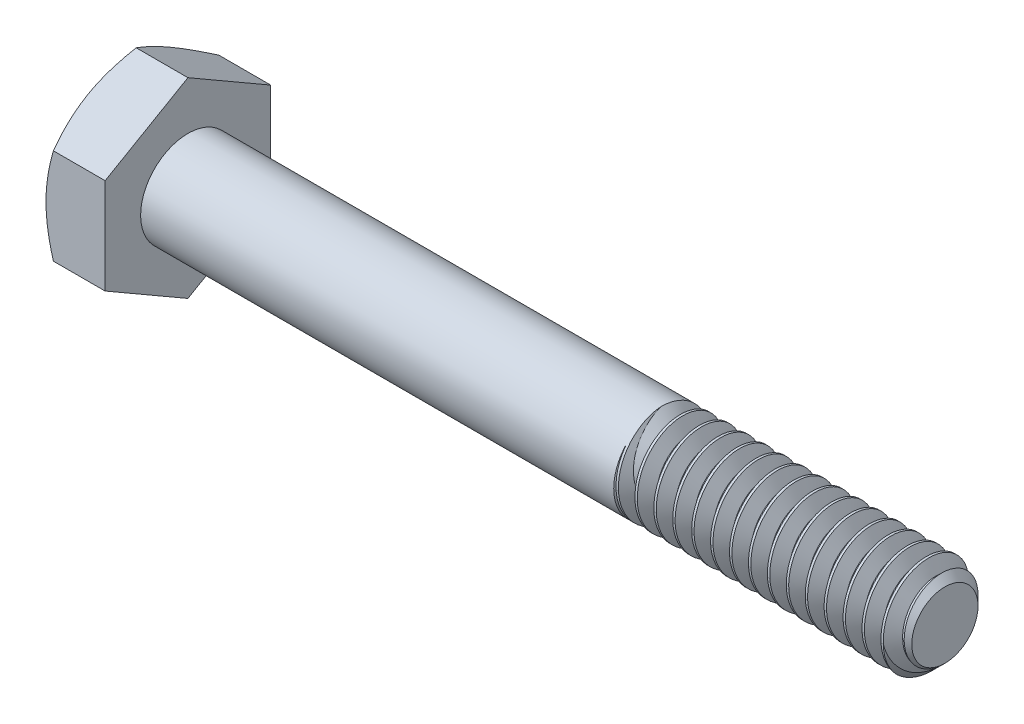
from build123d import *

# Parameters (mm, degrees)
SKETCH5_R           = 3.175
BOSS_EXTRUDE3_DEPTH = 50.8
CHAMFER1_SIZE       = 0.9525
CUT_SWEEP1_PITCH    = 1.27
BOSS_EXTRUDE4_DEPTH = 3.96875
SKETCH8_OUTSIDE_W   = 220.032
SKETCH8_OUTSIDE_H   = 221.752
SKETCH8_OUTSIDE_R   = 5.55625
CUT_EXTRUDE3_DEPTH  = 56.422472461
CUT_EXTRUDE3_DRAFT  = -60


with BuildPart() as part:
    # Sketch5 → Boss-Extrude3 (new body)
    with BuildSketch(Plane(origin=(27.384375, 0, 0), x_dir=(0, 0, -1), z_dir=(1, 0, 0))):
        Circle(SKETCH5_R)
    extrude(amount=-BOSS_EXTRUDE3_DEPTH)

    # Chamfer1
    chamfer1_edges = [part.edges().sort_by_distance(p)[0] for p in [
        (27.384375, 0, 3.175),
    ]]
    chamfer(chamfer1_edges, length=CHAMFER1_SIZE)

    # Cut-Sweep1: the profile of Sketch10 profile screwed along a right-hand helix of 16 turns, 8 arcs to a turn; built about Z, then put on its axis
    cut_sweep1_z = Axis((0, 0, 0), (0, 0, 1))
    cut_sweep1_corners = [(3.1753, 0, 0.000173205), (2.350110803, 0, -0.47625), (2.350110803, 0, -0.635), (3.1753, 0, -1.111423205)]
    with BuildLine(mode=Mode.PRIVATE) as cut_sweep1_profile:
        Line(cut_sweep1_corners[0], cut_sweep1_corners[1])
        Line(cut_sweep1_corners[1], cut_sweep1_corners[2])
        Line(cut_sweep1_corners[2], cut_sweep1_corners[3])
        Line(cut_sweep1_corners[3], cut_sweep1_corners[0])
    cut_sweep1_cap = Face(cut_sweep1_profile.wire())
    cut_sweep1_turn_angles = [0, 22.5, 45, 67.5, 90, 112.5, 135, 157.5, 180, 202.5, 225, 247.5, 270, 292.5, 315, 337.5, 360]
    cut_sweep1_turn_weights = [1, 0.9238795325112867, 1, 0.9238795325112867, 1, 0.9238795325112867, 1, 0.9238795325112867, 1, 0.9238795325112867, 1, 0.9238795325112867, 1, 0.9238795325112867, 1, 0.9238795325112867, 1]
    cut_sweep1_turn_rails = [Edge.make_bspline([Vector(p[0], p[1], 0).rotate(cut_sweep1_z, cut_sweep1_turn_angles[k]) / cut_sweep1_turn_weights[k] + Vector(0, 0, p[2] + CUT_SWEEP1_PITCH * cut_sweep1_turn_angles[k] / 360) for k in range(17)], [0, 0, 0, 1, 1, 2, 2, 3, 3, 4, 4, 5, 5, 6, 6, 7, 7, 8, 8, 8], 2, cut_sweep1_turn_weights) for p in cut_sweep1_corners]
    cut_sweep1_turn_sides = [Face.make_surface_from_curves(cut_sweep1_turn_rails[p[0]], cut_sweep1_turn_rails[p[1]]) for p in [(0, 1), (1, 2), (2, 3), (3, 0)]]
    cut_sweep1 = Plane(origin=(27.384375, 0, 0), x_dir=(0, 1, 0), z_dir=(-1, 0, 0)) * Solid(Shell([*[p.moved(Location((0, 0, CUT_SWEEP1_PITCH * i))) for i in range(16) for p in cut_sweep1_turn_sides], cut_sweep1_cap, cut_sweep1_cap.rotate(cut_sweep1_z, 5760).moved(Location((0, 0, CUT_SWEEP1_PITCH * 5760 / 360)))]))
    add(cut_sweep1, mode=Mode.SUBTRACT)

    # Sketch11 → Revolve1 (revolve)
    with BuildSketch(Plane.XY, mode=Mode.PRIVATE) as revolve1_sk:
        Polygon((-23.415625, 3.175), (-23.415625, 0), (11.509375, 0), (8.334375, 3.175), align=None)
    revolve(revolve1_sk.sketch.rotate(Axis((-23.415625, 0, 0), (1, 0, 0)), 270), axis=Axis((-23.415625, 0, 0), (1, 0, 0)))

    # Sketch6 → Boss-Extrude4 (add)
    with BuildSketch(Plane.ZY.offset(23.415625)):
        Polygon((5.55625, 3.207902433), (0, 6.415804866), (-5.55625, 3.207902433), (-5.55625, -3.207902433), (0, -6.415804866), (5.55625, -3.207902433), align=None)
    extrude(amount=BOSS_EXTRUDE4_DEPTH)


with BuildPart() as cut_extrude3_tool:
    # Sketch8 outside → Cut-Extrude3 (with draft: the straight prism first)
    with BuildSketch(Plane.ZY.offset(27.384375)):
        Rectangle(SKETCH8_OUTSIDE_W, SKETCH8_OUTSIDE_H)
        Circle(SKETCH8_OUTSIDE_R, mode=Mode.SUBTRACT)
    extrude(amount=-CUT_EXTRUDE3_DEPTH)
    # Cut-Extrude3: the draft: its side faces are tilted about the plane it starts from
    cut_extrude3_sides = [cut_extrude3_tool.faces().sort_by_distance(p)[0] for p in [
        (0.82686123, -110.876, 0),
        (0.82686123, 0, 110.016),
        (0.82686123, 110.876, 0),
        (0.82686123, 0, -110.016),
        (0.82686123, 0, -5.55625),
    ]]
    draft(cut_extrude3_sides, Plane.ZY.offset(27.384375), CUT_EXTRUDE3_DRAFT)


with BuildPart() as part_1:
    add(part.part)

    # Cut-Extrude3: cut by cut_extrude3_tool
    add(cut_extrude3_tool.part, mode=Mode.SUBTRACT)


solid = part_1.part
